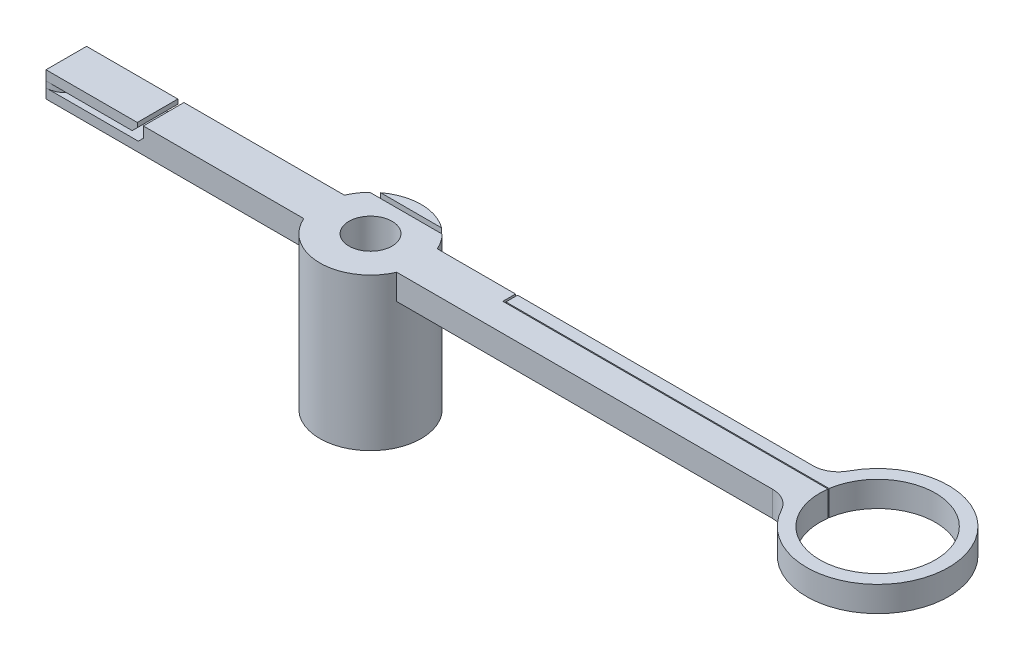
from build123d import *

# Parameters (mm, degrees)
SKETCH_1_R              = 14
SKETCH_1_R_2            = 11.4
RING_DEPTH              = 5
STICK_DEPTH             = 5
FILLET_1_R              = 5
CORRECTION_HOLE_1_DEPTH = 161.68914089
CUT_EXTRUDE_1_REACH     = 163.087
FILLET_2_R              = 4
SKETCH_10_R             = 10
EXTRUDE_2_DEPTH         = 30
SKETCH_11_R             = 4.25
CUT_EXTRUDE_3_DEPTH     = 30
SKETCH_12_W             = 14.282856858
SKETCH_12_H             = 1
CUT_EXTRUDE_4_DEPTH     = 5
SKETCH_13_W             = 14.282856858
SKETCH_13_H             = 1
CUT_EXTRUDE_6_DEPTH     = 5


with BuildPart() as part:
    # Эскиз1 → ring (new body)
    with BuildSketch(Plane(origin=(0, 0, 0), x_dir=(1, 0, 0), z_dir=(0, 1, 0))):
        with Locations(Location((0, 0, 0), (0, 0, 270))):
            Circle(SKETCH_1_R)
        with Locations(Location((0, 0, 0), (0, 0, 270))):
            Circle(SKETCH_1_R_2, mode=Mode.SUBTRACT)
    extrude(amount=RING_DEPTH)

    # Эскиз2 → stick (add)
    with BuildSketch(Plane(origin=(0, 0, 0), x_dir=(1, 0, 0), z_dir=(0, 1, 0))):
        with BuildLine():
            Line((-10.781929326, 4), (-160, 4))
            Line((-160, 4), (-160, -4))
            Line((-160, -4), (-10.781929326, -4))
            ThreePointArc((-10.781929326, -4), (-11.5, 0), (-10.781929326, 4))
        make_face()
    extrude(amount=STICK_DEPTH)

    # Скругление1
    fillet_1_edges = [part.edges().sort_by_distance(p)[0] for p in [
        (-13.416407865, 2.5, 4),
        (-13.416407865, 2.5, -4),
    ]]
    fillet(fillet_1_edges, radius=FILLET_1_R)

    # Эскиз5 → correction hole 1 (cut, through all)
    with BuildSketch(Plane.XZ):
        Polygon((-75.4, -4), (-75.4, -1.5), (0, -1.5), (0, -1.7), (-75, -1.7), (-75, -4), align=None)
    extrude(amount=-CORRECTION_HOLE_1_DEPTH, mode=Mode.SUBTRACT)

    # Эскиз9 → Вытянуть1 (cut, up to next)
    with BuildSketch(Plane.XY.offset(4), mode=Mode.PRIVATE) as cut_extrude_1_sk1:
        Polygon((-142, 5), (-142, 4.1), (-143, 3.1), (-156, 3.1), (-156, 1.9), (-141.8, 1.9), (-140.8, 2.9), (-140.8, 5), align=None)
    cut_extrude_1_tool1 = extrude(cut_extrude_1_sk1.sketch, amount=-CUT_EXTRUDE_1_REACH, mode=Mode.PRIVATE) & part.part
    add(cut_extrude_1_tool1.solids().sort_by_distance((-147.651462, 2.701462, 4))[0], mode=Mode.SUBTRACT)

    # Скругление2
    fillet_2_edges = [part.edges().sort_by_distance(p)[0] for p in [
        (-156, 2.5, -4),
        (-156, 2.5, 4),
    ]]
    fillet(fillet_2_edges, radius=FILLET_2_R - 0.0001)  # a hair under: the kernel refuses the full size

    # Эскиз10 → Вытянуть2 (add)
    with BuildSketch(Plane(origin=(0, 5, 0), x_dir=(1, 0, 0), z_dir=(0, 1, 0))):
        with Locations(Location((-100, 0, 0), (0, 0, 270))):
            Circle(SKETCH_10_R)
    extrude(amount=-EXTRUDE_2_DEPTH)

    # Эскиз11 → Вытянуть3 (cut)
    with BuildSketch(Plane.XZ.offset(25)):
        with Locations(Location((-100, 0, 0), (0, 0, 270))):
            Circle(SKETCH_11_R)
    extrude(amount=-CUT_EXTRUDE_3_DEPTH, mode=Mode.SUBTRACT)

    # Эскиз12 → Вытянуть4 (cut)
    with BuildSketch(Plane.XZ.offset(25)):
        with Locations((-100, -7.5)):
            Rectangle(SKETCH_12_W, SKETCH_12_H)
    extrude(amount=-CUT_EXTRUDE_4_DEPTH, mode=Mode.SUBTRACT)

    # Эскиз13 → Вытянуть6 (cut)
    with BuildSketch(Plane(origin=(0, 5, 0), x_dir=(1, 0, 0), z_dir=(0, 1, 0))):
        with Locations((-100, 7.5)):
            Rectangle(SKETCH_13_W, SKETCH_13_H)
    extrude(amount=-CUT_EXTRUDE_6_DEPTH, mode=Mode.SUBTRACT)


solid = part.part
